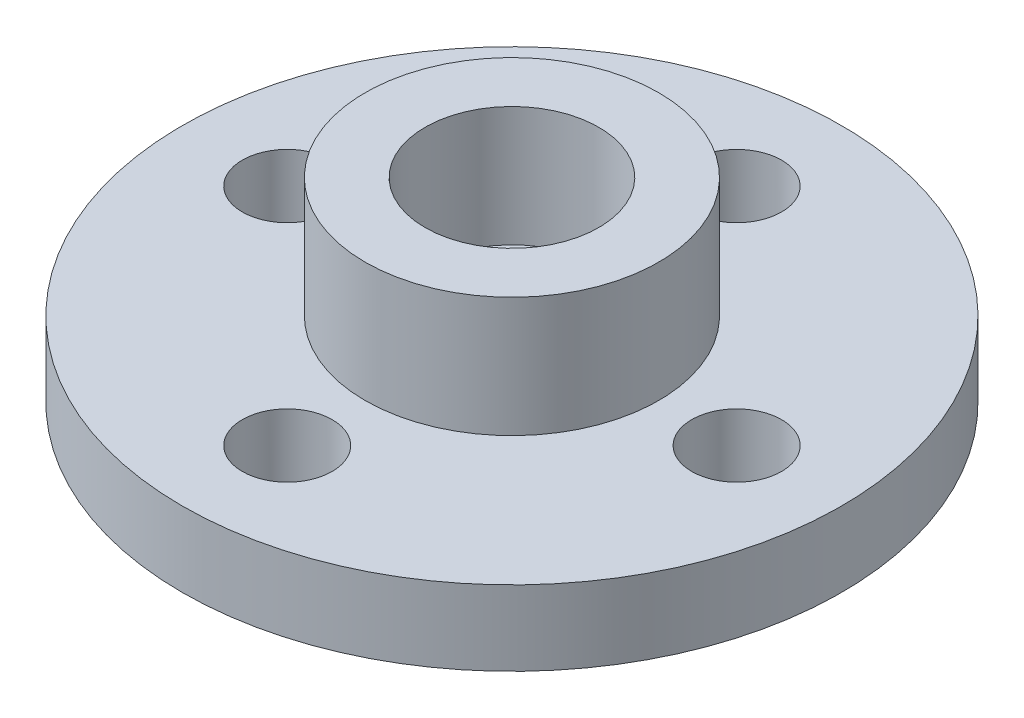
from build123d import *

# Parameters (mm, degrees)
SKETCH1_R           = 11
BOSS_EXTRUDE1_DEPTH = 2.5
SKETCH2_R           = 1.5
CUT_EXTRUDE1_DEPTH  = 3
SKETCH3_R           = 4.9
SKETCH3_R_2         = 2.9
BOSS_EXTRUDE2_DEPTH = 4


with BuildPart() as part:
    # Sketch1 → Boss-Extrude1 (new body)
    with BuildSketch(Plane(origin=(0, 0, 0), x_dir=(1, 0, 0), z_dir=(0, 1, 0))):
        Circle(SKETCH1_R)
    extrude(amount=BOSS_EXTRUDE1_DEPTH)

    # Sketch2 → Cut-Extrude1 (cut)
    with BuildSketch(Plane(origin=(0, 2.5, 0), x_dir=(1, 0, 0), z_dir=(0, 1, 0))):
        with Locations((7.5, 0)):
            Circle(SKETCH2_R)
        Circle(SKETCH2_R)
        with Locations((0, 7.5)):
            Circle(SKETCH2_R)
        with Locations((-7.5, 0)):
            Circle(SKETCH2_R)
        with Locations((0, -7.5)):
            Circle(SKETCH2_R)
    extrude(amount=-CUT_EXTRUDE1_DEPTH, mode=Mode.SUBTRACT)

    # Sketch3 → Boss-Extrude2 (add)
    with BuildSketch(Plane(origin=(0, 2.5, 0), x_dir=(1, 0, 0), z_dir=(0, 1, 0))):
        Circle(SKETCH3_R)
        Circle(SKETCH3_R_2, mode=Mode.SUBTRACT)
    extrude(amount=BOSS_EXTRUDE2_DEPTH)


solid = part.part
